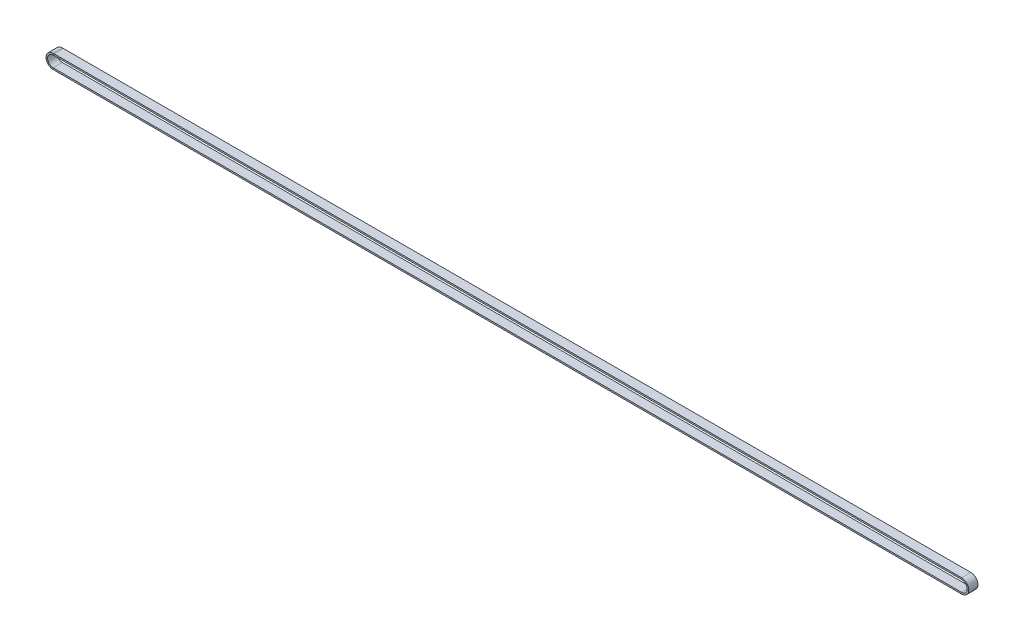
from build123d import *

# Parameters (mm, degrees)
SKETCH3_W = 9
SKETCH3_H = 1.5


with BuildPart() as part:
    # Sweep1: sweep along a path in Sketch2
    with BuildLine(Plane.XY.offset(-16.233366658)) as sweep1_path:
        Line((-1, -57.890228286), (883.520637828, -57.890228286))
        ThreePointArc((883.520637828, -57.890228286), (890.420637828, -64.790228286), (883.520637828, -71.690228286))
        Line((883.520637828, -71.690228286), (-1, -71.690228286))
        ThreePointArc((-1, -71.690228286), (-7.9, -64.790228286), (-1, -57.890228286))
    # Sketch3 → Sweep1 (sweep)
    with BuildSketch(Plane(origin=(0, 0, 0), x_dir=(0, 0, -1), z_dir=(1, 0, 0))):
        with Locations((11.733366658, -58.640228286)):
            Rectangle(SKETCH3_W, SKETCH3_H)
    sweep(path=sweep1_path.line)


solid = part.part
